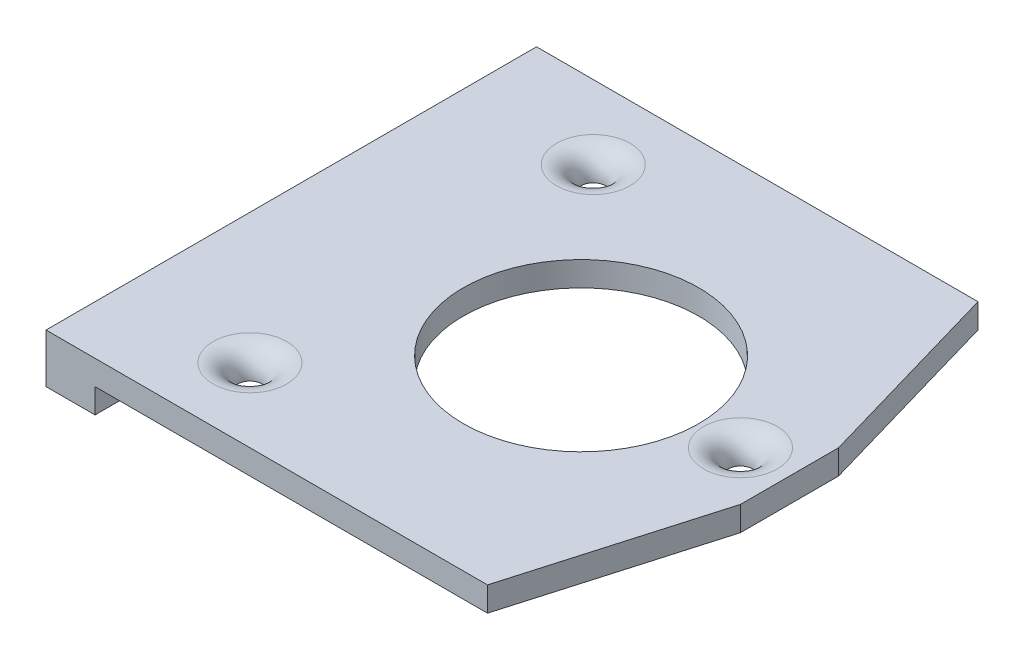
from build123d import *

# Parameters (mm, degrees)
SKETCH3_R           = 1.5875
SKETCH3_R_2         = 15.24
BOSS_EXTRUDE1_DEPTH = 3.175
SKETCH4_W           = 63.5
SKETCH4_H           = 6.35
BOSS_EXTRUDE2_DEPTH = 6.35
FILLET1_R           = 3.175


with BuildPart() as part:
    # Sketch3 → Boss-Extrude1 (new body)
    with BuildSketch(Plane(origin=(0, 0, 0), x_dir=(1, 0, 0), z_dir=(0, 1, 0))):
        Polygon((0, 31.75), (0, -31.75), (50.8, -31.75), (58.15, -6.35), (58.15, 6.35), (50.8, 31.75), align=None)
        with Locations(Location((51.8, 0, 0), (0, 0, 270))):
            Circle(SKETCH3_R, mode=Mode.SUBTRACT)
        with Locations(Location((10.525, 22.225, 0), (0, 0, 270))):
            Circle(SKETCH3_R, mode=Mode.SUBTRACT)
        with Locations(Location((10.525, -22.225, 0), (0, 0, 270))):
            Circle(SKETCH3_R, mode=Mode.SUBTRACT)
        with Locations(Location((31.1625, 0, 0), (0, 0, 270))):
            Circle(SKETCH3_R_2, mode=Mode.SUBTRACT)
    extrude(amount=BOSS_EXTRUDE1_DEPTH)

    # Sketch4 → Boss-Extrude2 (add)
    with BuildSketch(Plane.ZY):
        Rectangle(SKETCH4_W, SKETCH4_H)
    extrude(amount=BOSS_EXTRUDE2_DEPTH)

    # Fillet1
    fillet1_edges = [part.edges().sort_by_distance(p)[0] for p in [
        (10.525, 3.175, -23.8125),
        (10.525, 3.175, 20.6375),
        (51.8, 3.175, -1.5875),
    ]]
    fillet(fillet1_edges, radius=FILLET1_R - 0.0001)  # a hair under: the kernel refuses the full size


solid = part.part
